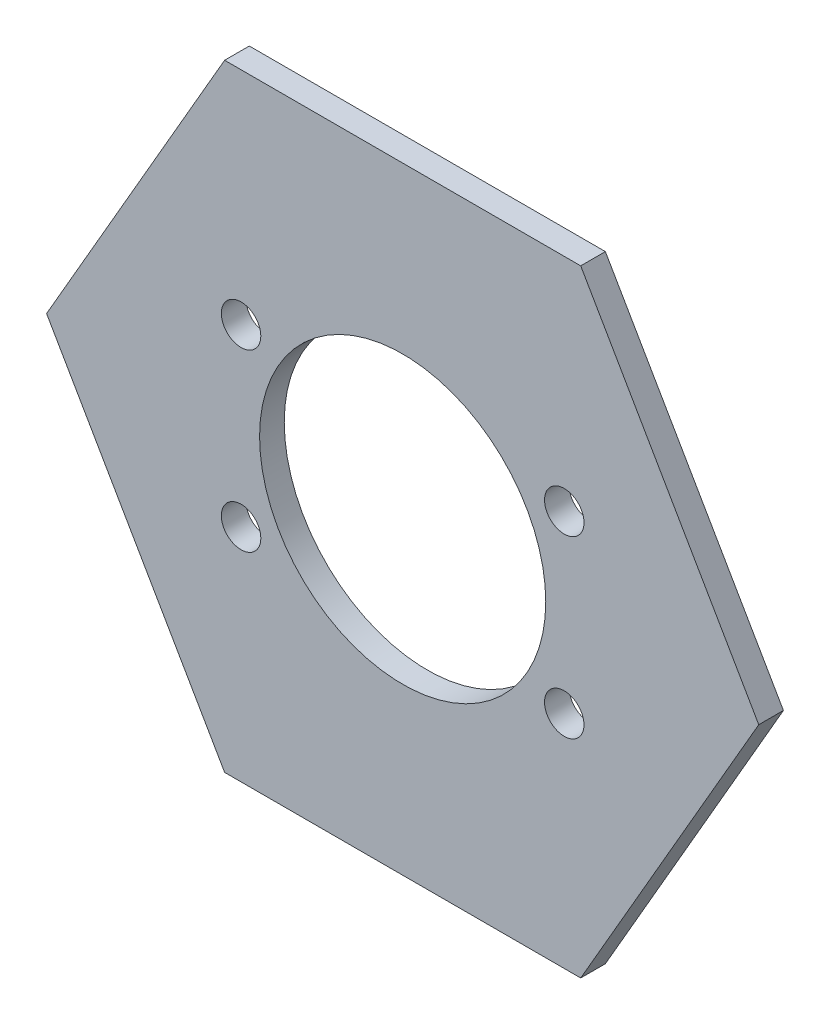
from build123d import *

# Parameters (mm, degrees)
SKETCH1_R           = 11.6
SKETCH1_R_2         = 1.6
BOSS_EXTRUDE1_DEPTH = 2


with BuildPart() as part:
    # Sketch1 → Boss-Extrude1 (new body)
    with BuildSketch(Plane.XY):
        Polygon((-14.43375673, 25), (14.43375673, 25), (28.867513459, 0), (14.43375673, -25), (-14.43375673, -25), (-28.867513459, 0), align=None)
        Circle(SKETCH1_R, mode=Mode.SUBTRACT)
        with Locations((-13.1, -7.1)):
            Circle(SKETCH1_R_2, mode=Mode.SUBTRACT)
        with Locations((-13.1, 7.1)):
            Circle(SKETCH1_R_2, mode=Mode.SUBTRACT)
        with Locations((13.1, 7.1)):
            Circle(SKETCH1_R_2, mode=Mode.SUBTRACT)
        with Locations((13.1, -7.1)):
            Circle(SKETCH1_R_2, mode=Mode.SUBTRACT)
    extrude(amount=BOSS_EXTRUDE1_DEPTH)


solid = part.part
